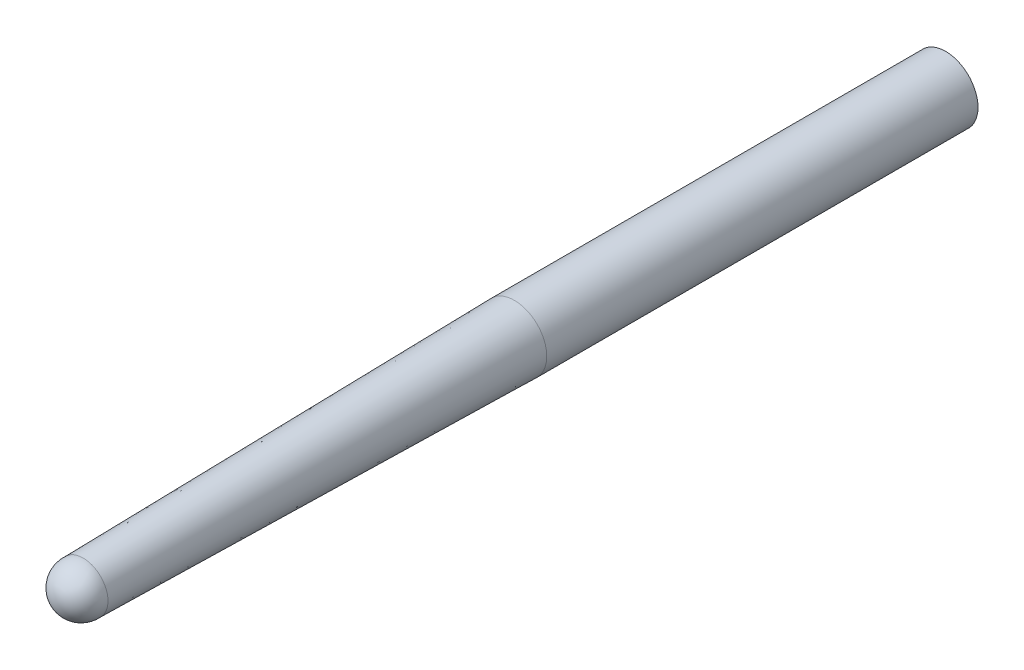
from build123d import *

# Parameters (mm, degrees)
SKETCH_1_R         = 6
EXTRUDE_2_DEPTH    = 80
DOME_1_FACE_RADIUS = 4.603594806
DOME_1_HEIGHT      = 5


# Read off the part's stored shape, not the designer's step: 拔模2
with BuildPart() as part:
    # 草图1 → 凸台-拉伸2 (new, symmetric)
    with BuildSketch(Plane.XY):
        Circle(SKETCH_1_R)
    extrude(amount=EXTRUDE_2_DEPTH, both=True)

    # 拔模2 outline → 拔模2 (revolve, cut)
    with BuildSketch(Plane.XZ):
        Polygon((6, 80), (4.603594806, 80), (6, 0), align=None)
    revolve(axis=Axis((0, 0, 0), (0, 0, 1)), mode=Mode.SUBTRACT)

    # 圆顶1: a dome of height H over a round flat face of radius A is a cap of a sphere of radius (A * A + H * H) / (2 * H)
    dome_1_r = (DOME_1_FACE_RADIUS * DOME_1_FACE_RADIUS + DOME_1_HEIGHT * DOME_1_HEIGHT) / (2 * DOME_1_HEIGHT)
    dome_1_base = Plane((0, 0, 80), z_dir=(0, 0, 1))
    with Locations(dome_1_base.offset(DOME_1_HEIGHT - dome_1_r)):
        dome_1_ball = Sphere(dome_1_r, mode=Mode.PRIVATE)
    add(split(dome_1_ball, bisect_by=dome_1_base, keep=Keep.TOP, mode=Mode.PRIVATE))


solid = part.part
